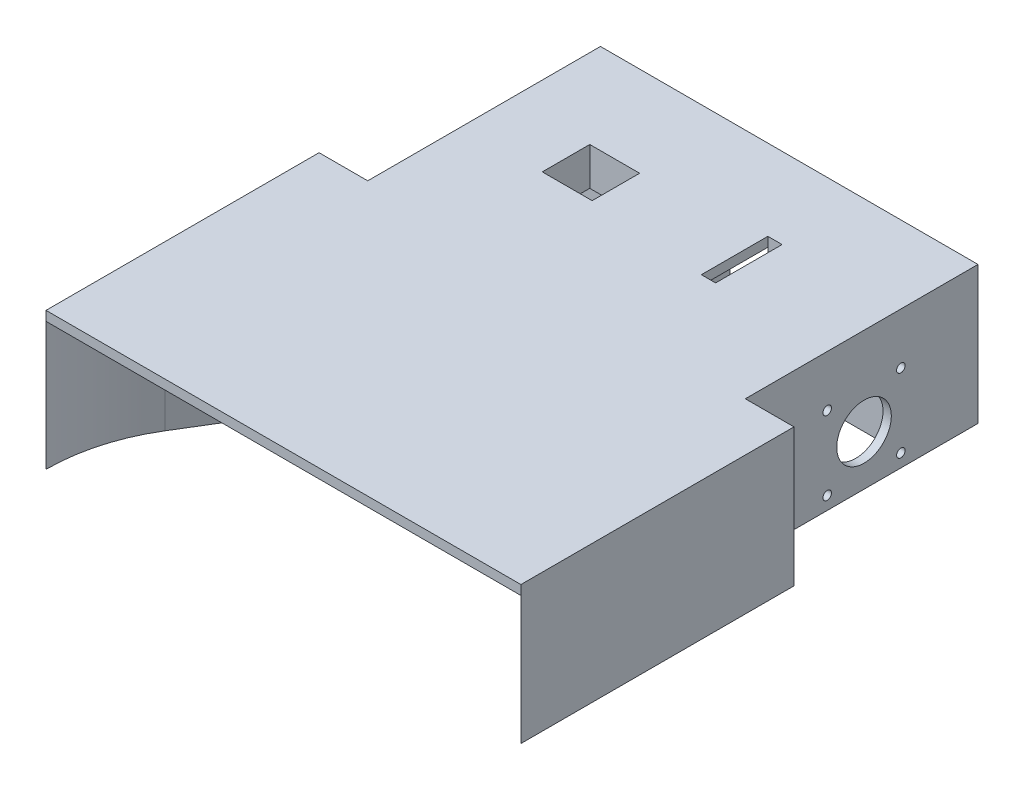
from build123d import *

# Parameters (mm, degrees)
SKETCH_1_W           = 200
SKETCH_1_H           = 213
EXTRUDE_1_DEPTH      = 4
EXTRUDE_2_DEPTH      = 54
CUT_EXTRUDE_2_DEPTH  = 298.880848663
CUT_EXTRUDE_3_DEPTH  = 42
SKETCH_7_R           = 1.8
SKETCH_7_R_2         = 11.5
CUT_EXTRUDE_4_DEPTH  = 282.53330176
MIRROR_START         = 176
MIRROR_1_OUTLINE_R   = 1.8
MIRROR_1_OUTLINE_R_2 = 11.5
MIRROR_1_DEPTH       = 3.5
SKETCH_8_W           = 27
SKETCH_8_H           = 28
CUT_EXTRUDE_5_DEPTH  = 6
SKETCH_9_W           = 27
SKETCH_9_H           = 20
CUT_EXTRUDE_6_DEPTH  = 21
CUT_EXTRUDE_START    = -54
CUT_EXTRUDE_7_DEPTH  = 54
SKETCH_14_W          = 21
SKETCH_14_H          = 20
CUT_EXTRUDE_8_DEPTH  = 296.18299409
SKETCH_15_W          = 6
SKETCH_15_H          = 28
CUT_EXTRUDE_9_DEPTH  = 296.18299409
SKETCH_12_R          = 2.6
CUT_EXTRUDE_10_DEPTH = 8
SKETCH_16_R          = 2.4
CUT_EXTRUDE_11_DEPTH = 3
SKETCH_17_R          = 1.75
CUT_EXTRUDE_12_DEPTH = 20


# Read off the part's stored shape, not the designer's step: 镜向1
with BuildPart() as part:
    # 草图1 → 凸台-拉伸1 (new body)
    with BuildSketch(Plane(origin=(0, 0, 0), x_dir=(1, 0, 0), z_dir=(0, 1, 0))):
        with Locations((100, 106.5)):
            Rectangle(SKETCH_1_W, SKETCH_1_H)
    extrude(amount=EXTRUDE_1_DEPTH)

    # 草图1<4> → 凸台-拉伸2 (add)
    with BuildSketch(Plane(origin=(0, 0, 0), x_dir=(1, 0, 0), z_dir=(0, 1, 0))):
        with BuildLine():
            Line((0, 213), (0, 0))
            ThreePointArc((0, 0), (21.966991411, 53.033008589), (75, 75))
            Line((75, 75), (75, 213))
            Line((75, 213), (0, 213))
        make_face()
        with BuildLine():
            Line((125, 213), (125, 75))
            ThreePointArc((125, 75), (178.033008589, 53.033008589), (200, 0))
            Line((200, 0), (200, 213))
            Line((200, 213), (125, 213))
        make_face()
    extrude(amount=-EXTRUDE_2_DEPTH)

    # 草图3 → 切除-拉伸2 (cut, through all)
    with BuildSketch(Plane.XZ.offset(54)):
        Polygon((20.5, -186), (20.5, -165), (20.5, -144), (20.5, -115), (0, -115), (0, -213), (20.5, -213), align=None)
        Polygon((179.5, -115), (200, -115), (200, -213), (179.5, -213), (179.5, -165), align=None)
    extrude(amount=-CUT_EXTRUDE_2_DEPTH, mode=Mode.SUBTRACT)

    # 草图5 → 切除-拉伸3 (cut)
    with BuildSketch(Plane.XZ.offset(54)):
        Polygon((176, -164), (176, -144), (125, -144), (125, -186), (176, -186), align=None)
        Polygon((24, -164), (24, -144), (75, -144), (75, -186), (24, -186), align=None)
    extrude(amount=-CUT_EXTRUDE_3_DEPTH, mode=Mode.SUBTRACT)

    # 草图7 → 切除-拉伸4 (cut, through all)
    with BuildSketch(Plane(origin=(24, 0, 0), x_dir=(0, 0, -1), z_dir=(1, 0, 0))):
        with Locations((180.5, -17.5)):
            Circle(SKETCH_7_R)
        with Locations((149.5, -17.5)):
            Circle(SKETCH_7_R)
        with Locations((165, -33)):
            Circle(SKETCH_7_R_2)
        with Locations((180.5, -48.5)):
            Circle(SKETCH_7_R)
        with Locations((149.5, -48.5)):
            Circle(SKETCH_7_R)
    extrude(amount=-CUT_EXTRUDE_4_DEPTH, mode=Mode.SUBTRACT)

    # 镜向1 outline → 镜向1 (cut)
    with BuildSketch(Plane.YZ.offset(MIRROR_START)):
        with Locations((-17.5, -180.5)):
            Circle(MIRROR_1_OUTLINE_R)
        with Locations((-17.5, -149.5)):
            Circle(MIRROR_1_OUTLINE_R)
        with Locations((-33, -165)):
            Circle(MIRROR_1_OUTLINE_R_2)
        with Locations((-48.5, -180.5)):
            Circle(MIRROR_1_OUTLINE_R)
        with Locations((-48.5, -149.5)):
            Circle(MIRROR_1_OUTLINE_R)
    extrude(amount=MIRROR_1_DEPTH, mode=Mode.SUBTRACT)

    # 草图8 → 切除-拉伸5 (cut)
    with BuildSketch(Plane(origin=(75, 0, 0), x_dir=(0, 0, -1), z_dir=(1, 0, 0))):
        with Locations((199.5, -33)):
            Rectangle(SKETCH_8_W, SKETCH_8_H)
    extrude(amount=-CUT_EXTRUDE_5_DEPTH, mode=Mode.SUBTRACT)

    # 草图9 → 切除-拉伸6 (cut)
    with BuildSketch(Plane.ZY.offset(-125)):
        with Locations((-199.5, -33)):
            Rectangle(SKETCH_9_W, SKETCH_9_H)
    extrude(amount=-CUT_EXTRUDE_6_DEPTH, mode=Mode.SUBTRACT)

    # 草图11 → 切除-拉伸7 (cut)
    with BuildSketch(Plane.XZ.offset(54).offset(CUT_EXTRUDE_START)):
        with BuildLine():
            Line((29.658534166, -69.684244774), (10.975621098, -39.0625))
            ThreePointArc((10.975621098, -39.0625), (38.289562111, -65.401404801), (75, -75))
            Line((75, -75), (75, -144))
            ThreePointArc((75, -144), (37.483837038, -124.777752739), (31.171635941, -83.099060455))
            ThreePointArc((31.171635941, -83.099060455), (31.899182276, -76.224256342), (29.658534166, -69.684244774))
        make_face()
        with BuildLine():
            Line((125, -144), (125, -75))
            ThreePointArc((125, -75), (161.710437889, -65.401404801), (189.024378902, -39.0625))
            Line((189.024378902, -39.0625), (170.341465834, -69.684244774))
            ThreePointArc((170.341465834, -69.684244774), (168.100817724, -76.224256342), (168.828364059, -83.099060455))
            ThreePointArc((168.828364059, -83.099060455), (162.516162962, -124.777752739), (125, -144))
        make_face()
    extrude(amount=CUT_EXTRUDE_7_DEPTH, mode=Mode.SUBTRACT)

    # 草图14 → 切除-拉伸8 (cut, through all)
    with BuildSketch(Plane.XZ.offset(12)):
        with Locations((64.5, -165)):
            Rectangle(SKETCH_14_W, SKETCH_14_H)
    extrude(amount=-CUT_EXTRUDE_8_DEPTH, mode=Mode.SUBTRACT)

    # 草图15 → 切除-拉伸9 (cut, through all)
    with BuildSketch(Plane.XZ.offset(12)):
        with Locations((128, -165)):
            Rectangle(SKETCH_15_W, SKETCH_15_H)
    extrude(amount=-CUT_EXTRUDE_9_DEPTH, mode=Mode.SUBTRACT)

    # 草图12 → 切除-拉伸10 (cut)
    with BuildSketch(Plane.XZ.offset(54)):
        with Locations(Location((16, -60.517578107, 0), (0, 0, 270))):
            Circle(SKETCH_12_R)
        with Locations(Location((16, -95.517578107, 0), (0, 0, 270))):
            Circle(SKETCH_12_R)
        with Locations(Location((184, -60.517578107, 0), (0, 0, 270))):
            Circle(SKETCH_12_R)
        with Locations(Location((184, -95.517578107, 0), (0, 0, 270))):
            Circle(SKETCH_12_R)
    extrude(amount=-CUT_EXTRUDE_10_DEPTH, mode=Mode.SUBTRACT)

    # 草图16 → 切除-拉伸11 (cut)
    with BuildSketch(Plane.XZ.offset(46)):
        with Locations(Location((184, -95.517578107, 0), (0, 0, 270))):
            Circle(SKETCH_16_R)
        with Locations(Location((184, -60.517578107, 0), (0, 0, 270))):
            Circle(SKETCH_16_R)
        with Locations(Location((16, -60.517578107, 0), (0, 0, 270))):
            Circle(SKETCH_16_R)
        with Locations(Location((16, -95.517578107, 0), (0, 0, 270))):
            Circle(SKETCH_16_R)
    extrude(amount=-CUT_EXTRUDE_11_DEPTH, mode=Mode.SUBTRACT)

    # 草图17 → 切除-拉伸12 (cut)
    with BuildSketch(Plane.XZ.offset(54)):
        with Locations(Location((16, -60.517578107, 0), (0, 0, 270))):
            Circle(SKETCH_17_R)
        with Locations(Location((16, -95.517578107, 0), (0, 0, 270))):
            Circle(SKETCH_17_R)
        with Locations(Location((184, -95.517578107, 0), (0, 0, 270))):
            Circle(SKETCH_17_R)
        with Locations(Location((184, -60.517578107, 0), (0, 0, 270))):
            Circle(SKETCH_17_R)
    extrude(amount=-CUT_EXTRUDE_12_DEPTH, mode=Mode.SUBTRACT)


solid = part.part
